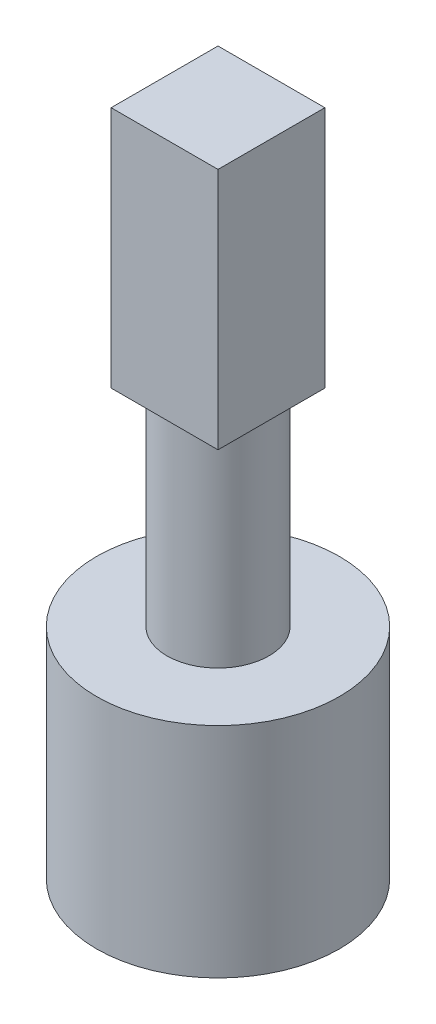
from build123d import *

# Parameters (mm, degrees)
SKETCH1_R           = 5
SKETCH1_W           = 6.6
SKETCH1_H           = 5.1
BOSS_EXTRUDE1_DEPTH = 5
SKETCH2_R           = 5
BOSS_EXTRUDE2_DEPTH = 4
SKETCH3_R           = 2.1
BOSS_EXTRUDE3_DEPTH = 8.5
SKETCH4_W           = 4.4
SKETCH4_H           = 4.4
BOSS_EXTRUDE4_DEPTH = 10


with BuildPart() as part:
    # Sketch1 → Boss-Extrude1 (new body)
    with BuildSketch(Plane(origin=(0, 0, 0), x_dir=(1, 0, 0), z_dir=(0, 1, 0))):
        Circle(SKETCH1_R)
        Rectangle(SKETCH1_W, SKETCH1_H, mode=Mode.SUBTRACT)
    extrude(amount=BOSS_EXTRUDE1_DEPTH)

    # Sketch2 → Boss-Extrude2 (add)
    with BuildSketch(Plane(origin=(0, 5, 0), x_dir=(1, 0, 0), z_dir=(0, 1, 0))):
        Circle(SKETCH2_R)
    extrude(amount=BOSS_EXTRUDE2_DEPTH)

    # Sketch3 → Boss-Extrude3 (add)
    with BuildSketch(Plane(origin=(0, 9, 0), x_dir=(1, 0, 0), z_dir=(0, 1, 0))):
        Circle(SKETCH3_R)
    extrude(amount=BOSS_EXTRUDE3_DEPTH)

    # Sketch4 → Boss-Extrude4 (add)
    with BuildSketch(Plane(origin=(0, 17.5, 0), x_dir=(1, 0, 0), z_dir=(0, 1, 0))):
        Rectangle(SKETCH4_W, SKETCH4_H)
    extrude(amount=BOSS_EXTRUDE4_DEPTH)


solid = part.part
